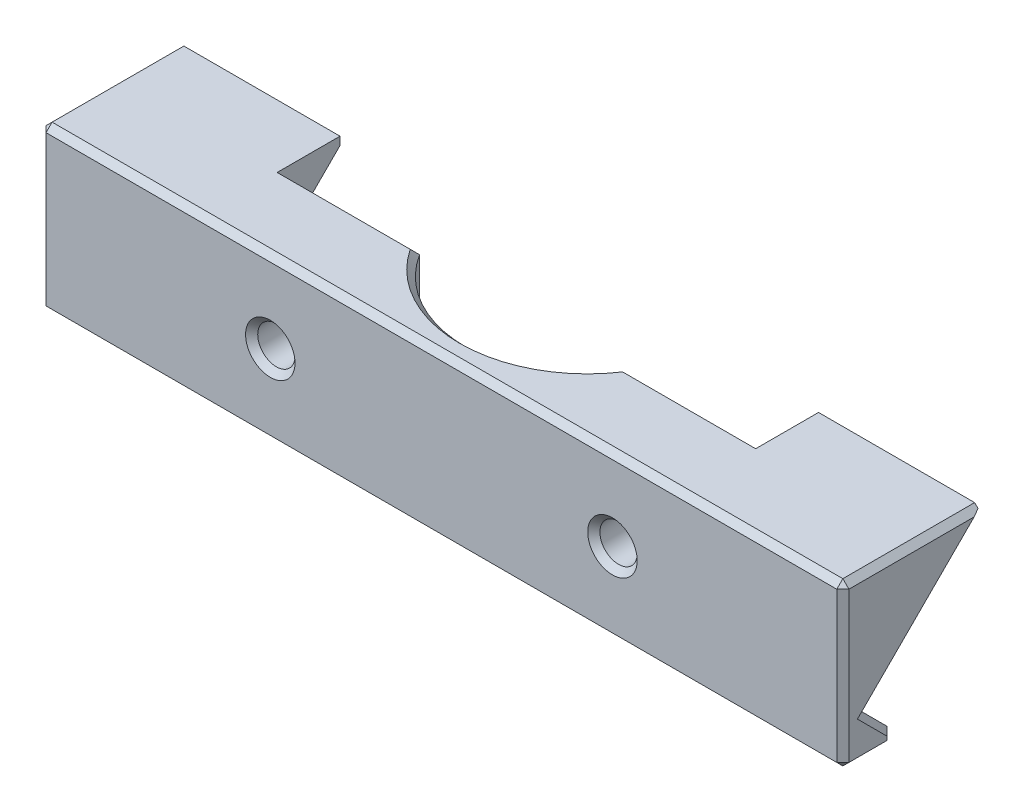
from build123d import *

# Parameters (mm, degrees)
SKIZZE1_W                       = 59
SKIZZE1_H                       = 20
AUFSATZ_LINEAR_AUSTRAGEN1_DEPTH = 10
AUFSATZ_LINEAR_AUSTRAGEN2_DEPTH = 20
SKIZZE3_R                       = 15
SCHNITT_LINEAR_AUSTRAGEN1_DEPTH = 20
SKIZZE4_R                       = 2.3
SCHNITT_LINEAR_AUSTRAGEN2_DEPTH = 10
SKIZZE5_R                       = 3.75
SCHNITT_LINEAR_AUSTRAGEN3_DEPTH = 3
SCHNITT_LINEAR_AUSTRAGEN4_DEPTH = 20
VERRUNDUNG1_R                   = 2


with BuildPart() as part:
    # Skizze1 → Aufsatz-Linear austragen1 (new body)
    with BuildSketch(Plane.XY):
        with Locations((0, 10)):
            Rectangle(SKIZZE1_W, SKIZZE1_H)
    extrude(amount=AUFSATZ_LINEAR_AUSTRAGEN1_DEPTH)

    # Skizze2 → Aufsatz-Linear austragen2 (add)
    with BuildSketch(Plane.ZY.offset(29.5)):
        Polygon((7.142135624, 4.857864376), (-7, 19), (-7, 20), (0, 20), (10, 20), (10, 0), (2.284271247, 0), align=None)
    aufsatz_linear_austragen2 = extrude(amount=AUFSATZ_LINEAR_AUSTRAGEN2_DEPTH)

    # Spiegeln1: Aufsatz-Linear austragen2 across plane
    add(aufsatz_linear_austragen2.mirror(Plane(origin=(0, 0, 0), x_dir=(0, 0, 1), z_dir=(1, 0, 0))))

    # Skizze3 → Schnitt-Linear austragen1 (cut)
    with BuildSketch(Plane.XZ):
        with Locations((0, -8)):
            Circle(SKIZZE3_R)
    extrude(amount=-SCHNITT_LINEAR_AUSTRAGEN1_DEPTH, mode=Mode.SUBTRACT)

    # Skizze4 → Schnitt-Linear austragen2 (cut)
    with BuildSketch(Plane(origin=(0, 0, 0), x_dir=(-1, 0, 0), z_dir=(0, 0, -1))):
        with Locations((-21.09428877, 10)):
            Circle(SKIZZE4_R)
        with Locations(Location((21.09428877, 10, 0), (0, 0, 180))):
            Circle(SKIZZE4_R)
    extrude(amount=-SCHNITT_LINEAR_AUSTRAGEN2_DEPTH, mode=Mode.SUBTRACT)

    # Skizze5 → Schnitt-Linear austragen3 (cut)
    with BuildSketch(Plane(origin=(0, 0, 0), x_dir=(-1, 0, 0), z_dir=(0, 0, -1))):
        with Locations((-21.09428877, 10)):
            Circle(SKIZZE5_R)
        with Locations((21.09428877, 10)):
            Circle(SKIZZE5_R)
    extrude(amount=-SCHNITT_LINEAR_AUSTRAGEN3_DEPTH, mode=Mode.SUBTRACT)

    # Skizze6 → Schnitt-Linear austragen4 (cut)
    with BuildSketch(Plane(origin=(49.5, 0, 0), x_dir=(0, 0, -1), z_dir=(1, 0, 0))):
        Polygon((-3.784271247, 1.5), (-3.784271247, 0), (-1.831080062, -0.949282867), (-1.396270995, 1.527811212), align=None)
    schnitt_linear_austragen4 = extrude(amount=-SCHNITT_LINEAR_AUSTRAGEN4_DEPTH, mode=Mode.SUBTRACT)

    # Spiegeln2: Schnitt-Linear austragen4 across plane
    add(schnitt_linear_austragen4.mirror(Plane(origin=(0, 0, 0), x_dir=(0, 0, 1), z_dir=(1, 0, 0))), mode=Mode.SUBTRACT)

    # Fase1
    # the kernel refuses this chamfer: 0.75 mm, written as the material it takes off along each edge
    with BuildSketch(Plane(origin=(49, 19.5, 9.5), x_dir=(-0.7071067811865492, 0.7071067811865459, 0), z_dir=(0.5773502691896248, 0.5773502691896276, 0.5773502691896248)), Plane(origin=(-49, 19.5, 9.5), x_dir=(-0.7071067811865492, -0.7071067811865459, 0), z_dir=(-0.5773502691896248, 0.5773502691896276, 0.5773502691896248))) as fase1_piece_1:
        Polygon((-0.530330086, -0.306186218), (0.530330086, -0.306186218), (0, 0.612372436), align=None)
    extrude(amount=0.952627944, mode=Mode.SUBTRACT)
    with BuildSketch(Plane(origin=(49, 0.5, 4.284271247), x_dir=(-0.7071067811865476, -1.4654196281048569e-15, -0.7071067811865476), z_dir=(0.5773502691896273, -0.5773502691896242, -0.577350269189626)), Plane(origin=(-49, 0.5, 9.5), x_dir=(-0.7071067811865458, 0.7071067811865491, 0), z_dir=(-0.5773502691896266, -0.577350269189624, 0.5773502691896268)), Plane(origin=(-49, 0.5, 4.284271247), x_dir=(0, 0.7071067811865487, -0.7071067811865464), z_dir=(-0.577350269189627, -0.5773502691896243, -0.5773502691896261)), Plane(origin=(49, 0.5, 9.5), x_dir=(-0.7071067811865457, -0.7071067811865492, 0), z_dir=(0.5773502691896267, -0.5773502691896237, 0.5773502691896267))) as fase1_piece_2:
        Polygon((-0.530330086, 0.306186218), (0.530330086, 0.306186218), (0, -0.612372436), align=None)
    extrude(amount=0.952627944, mode=Mode.SUBTRACT)
    with BuildSketch(Plane(origin=(-21.09428877, 10, 10), x_dir=(1, 0, 0), z_dir=(0, 1, 0))) as fase1_piece_3:
        with BuildLine():
            Line((2.278786797, 0.771213203), (3.071213203, -0.021213203))
            Line((3.071213203, -0.021213203), (3.071213203, -0.036213203))
            ThreePointArc((3.071213203, -0.036213203), (2.685606602, -0.015), (2.3, -0.015))
            Line((2.3, -0.015), (2.285, 0))
            ThreePointArc((2.285, 0), (2.285, 0.385606602), (2.263786797, 0.771213203))
            Line((2.263786797, 0.771213203), (2.278786797, 0.771213203))
        make_face()
    revolve(axis=Axis((-21.09428877, 10, 10), (0, 0, -1)), mode=Mode.SUBTRACT)
    with BuildSketch(Plane(origin=(21.09428877, 10, 10), x_dir=(-1, 0, 0), z_dir=(0, -1, 0))) as fase1_piece_4:
        with BuildLine():
            Line((3.071213203, -0.021213203), (2.278786797, 0.771213203))
            Line((2.278786797, 0.771213203), (2.263786797, 0.771213203))
            ThreePointArc((2.263786797, 0.771213203), (2.285, 0.385606602), (2.285, 0))
            Line((2.285, 0), (2.3, -0.015))
            ThreePointArc((2.3, -0.015), (2.685606602, -0.015), (3.071213203, -0.036213203))
            Line((3.071213203, -0.036213203), (3.071213203, -0.021213203))
        make_face()
    revolve(axis=Axis((21.09428877, 10, 10), (0, 0, -1)), mode=Mode.SUBTRACT)
    with BuildSketch(Plane(origin=(49.5, 20, 0), x_dir=(-0.9996219169112969, 0.027495876610582292, 0), z_dir=(0, 0, 1))) as fase1_piece_5:
        with BuildLine():
            Line((0.771504896, 0), (-0.042410366, 0.770338345))
            Line((-0.042410366, 0.770338345), (-0.057404695, 0.769925907))
            ThreePointArc((-0.057404695, 0.769925907), (-0.02559692, 0.385048372), (-0.014994329, -0.000412438))
            Line((-0.014994329, -0.000412438), (0.000412438, -0.014994329))
            ThreePointArc((0.000412438, -0.014994329), (0.385873249, -0.004391737), (0.771917335, -0.014994329))
            Line((0.771917335, -0.014994329), (0.771504896, 0))
        make_face()
    extrude(amount=11.928762241, mode=Mode.SUBTRACT)
    with BuildSketch(Plane(origin=(49.5, 4.857864376, 7.142135624), x_dir=(-0.9996219169112968, -0.01944252080601377, -0.01944252080601398), z_dir=(0, 0.7071067811865513, -0.7071067811865438)), Plane(origin=(51.428762241, 0, 3.784271247), x_dir=(0, -0.027495876610586376, 0.9996219169112968), z_dir=(-1, 0, 0))) as fase1_piece_6:
        with BuildLine():
            Line((0.771504896, 0), (-0.042410366, 0.770338345))
            Line((-0.042410366, 0.770338345), (-0.057404695, 0.769925907))
            ThreePointArc((-0.057404695, 0.769925907), (-0.02559692, 0.385048372), (-0.014994329, -0.000412438))
            Line((-0.014994329, -0.000412438), (0.000412438, -0.014994329))
            ThreePointArc((0.000412438, -0.014994329), (0.385873249, -0.004391737), (0.771917335, -0.014994329))
            Line((0.771917335, -0.014994329), (0.771504896, 0))
        make_face()
    extrude(amount=21.928762241, mode=Mode.SUBTRACT)
    with BuildSketch(Plane(origin=(49.5, 0.13615914, 2.420430388), x_dir=(-0.9996219169112968, 0.01944252080601445, -0.019442520806014447), z_dir=(0, 0.7071067811865475, 0.7071067811865476))) as fase1_piece_7:
        with BuildLine():
            Line((0.771504896, 0), (-0.042410366, 0.770338345))
            Line((-0.042410366, 0.770338345), (-0.057404695, 0.769925907))
            ThreePointArc((-0.057404695, 0.769925907), (-0.02559692, 0.385048372), (-0.014994329, -0.000412438))
            Line((-0.014994329, -0.000412438), (0.000412438, -0.014994329))
            ThreePointArc((0.000412438, -0.014994329), (0.385873249, -0.004391737), (0.771917335, -0.014994329))
            Line((0.771917335, -0.014994329), (0.771504896, 0))
        make_face()
    extrude(amount=6.677499583, mode=Mode.SUBTRACT)
    with BuildSketch(Plane(origin=(49.5, 3.428762241, 3.784271247), x_dir=(0.027495876610582164, 0, 0.9996219169112969), z_dir=(0, -1, 0)), Plane(origin=(-49.5, 3.428762241, 3.784271247), x_dir=(0.9996219169112968, 0, -0.027495876610586317), z_dir=(0, -1, 0))) as fase1_piece_8:
        with BuildLine():
            Line((0.771504896, 0), (-0.042410366, 0.770338345))
            Line((-0.042410366, 0.770338345), (-0.057404695, 0.769925907))
            ThreePointArc((-0.057404695, 0.769925907), (-0.02559692, 0.385048372), (-0.014994329, -0.000412438))
            Line((-0.014994329, -0.000412438), (0.000412438, -0.014994329))
            ThreePointArc((0.000412438, -0.014994329), (0.385873249, -0.004391737), (0.771917335, -0.014994329))
            Line((0.771917335, -0.014994329), (0.771504896, 0))
        make_face()
    extrude(amount=5.357524482, mode=Mode.SUBTRACT)
    with BuildSketch(Plane(origin=(-49.5, 0, 11.928762241), x_dir=(0.9996219169112968, -0.027495876610586487, 0), z_dir=(0, 0, -1))) as fase1_piece_9:
        with BuildLine():
            Line((0.771504896, 0), (-0.042410366, -0.770338345))
            Line((-0.042410366, -0.770338345), (-0.057404695, -0.769925907))
            ThreePointArc((-0.057404695, -0.769925907), (-0.02559692, -0.385048372), (-0.014994329, 0.000412438))
            Line((-0.014994329, 0.000412438), (0.000412438, 0.014994329))
            ThreePointArc((0.000412438, 0.014994329), (0.385873249, 0.004391737), (0.771917335, 0.014994329))
            Line((0.771917335, 0.014994329), (0.771504896, 0))
        make_face()
    extrude(amount=10.073253234, mode=Mode.SUBTRACT)
    with BuildSketch(Plane(origin=(49.5, 21.928762241, 10), x_dir=(-0.9996219169112968, 0, 0.027495876610586893), z_dir=(0, -1, 0)), Plane(origin=(-49.5, 21.928762241, 10), x_dir=(-0.027495876610582164, 0, -0.9996219169112969), z_dir=(0, -1, 0))) as fase1_piece_10:
        with BuildLine():
            Line((0.771504896, 0), (-0.042410366, 0.770338345))
            Line((-0.042410366, 0.770338345), (-0.057404695, 0.769925907))
            ThreePointArc((-0.057404695, 0.769925907), (-0.02559692, 0.385048372), (-0.014994329, -0.000412438))
            Line((-0.014994329, -0.000412438), (0.000412438, -0.014994329))
            ThreePointArc((0.000412438, -0.014994329), (0.385873249, -0.004391737), (0.771917335, -0.014994329))
            Line((0.771917335, -0.014994329), (0.771504896, 0))
        make_face()
    extrude(amount=23.857524482, mode=Mode.SUBTRACT)
    with BuildSketch(Plane(origin=(51.428762241, 20, 10), x_dir=(0, 0.027495876610586768, -0.9996219169112968), z_dir=(-1, 0, 0))) as fase1_piece_11:
        with BuildLine():
            Line((0.771504896, 0), (-0.042410366, 0.770338345))
            Line((-0.042410366, 0.770338345), (-0.057404695, 0.769925907))
            ThreePointArc((-0.057404695, 0.769925907), (-0.02559692, 0.385048372), (-0.014994329, -0.000412438))
            Line((-0.014994329, -0.000412438), (0.000412438, -0.014994329))
            ThreePointArc((0.000412438, -0.014994329), (0.385873249, -0.004391737), (0.771917335, -0.014994329))
            Line((0.771917335, -0.014994329), (0.771504896, 0))
        make_face()
    extrude(amount=102.857524482, mode=Mode.SUBTRACT)
    with BuildSketch(Plane(origin=(51.428762241, 0, 10), x_dir=(0, -0.02749587661058636, -0.9996219169112968), z_dir=(-1, 0, 0))) as fase1_piece_12:
        with BuildLine():
            Line((0.771504896, 0), (-0.042410366, -0.770338345))
            Line((-0.042410366, -0.770338345), (-0.057404695, -0.769925907))
            ThreePointArc((-0.057404695, -0.769925907), (-0.02559692, -0.385048372), (-0.014994329, 0.000412438))
            Line((-0.014994329, 0.000412438), (0.000412438, 0.014994329))
            ThreePointArc((0.000412438, 0.014994329), (0.385873249, 0.004391737), (0.771917335, 0.014994329))
            Line((0.771917335, 0.014994329), (0.771504896, 0))
        make_face()
    extrude(amount=102.857524482, mode=Mode.SUBTRACT)
    with BuildSketch(Plane(origin=(49.5, 0, 11.928762241), x_dir=(-0.9996219169112968, -0.027495876610586487, 0), z_dir=(0, 0, -1))) as fase1_piece_13:
        with BuildLine():
            Line((0.771504896, 0), (-0.042410366, 0.770338345))
            Line((-0.042410366, 0.770338345), (-0.057404695, 0.769925907))
            ThreePointArc((-0.057404695, 0.769925907), (-0.02559692, 0.385048372), (-0.014994329, -0.000412438))
            Line((-0.014994329, -0.000412438), (0.000412438, -0.014994329))
            ThreePointArc((0.000412438, -0.014994329), (0.385873249, -0.004391737), (0.771917335, -0.014994329))
            Line((0.771917335, -0.014994329), (0.771504896, 0))
        make_face()
    extrude(amount=10.073253234, mode=Mode.SUBTRACT)
    with BuildSketch(Plane(origin=(29.5, 0, -1.928762241), x_dir=(-0.9996219169112968, -0.02749587661058636, 0), z_dir=(0, 0, 1)), Plane(origin=(-29.5, 0, 3.784271247), x_dir=(0.9996219169112965, -0.027495876610589942, 0), z_dir=(0, 0, -1))) as fase1_piece_14:
        with BuildLine():
            Line((0.771504896, 0), (-0.042410366, -0.770338345))
            Line((-0.042410366, -0.770338345), (-0.057404695, -0.769925907))
            ThreePointArc((-0.057404695, -0.769925907), (-0.02559692, -0.385048372), (-0.014994329, 0.000412438))
            Line((-0.014994329, 0.000412438), (0.000412438, 0.014994329))
            ThreePointArc((0.000412438, 0.014994329), (0.385873249, 0.004391737), (0.771917335, 0.014994329))
            Line((0.771917335, 0.014994329), (0.771504896, 0))
        make_face()
    extrude(amount=5.713033488, mode=Mode.SUBTRACT)
    with BuildSketch(Plane(origin=(31.428762241, 0, 0), x_dir=(0, -0.027495876610586372, 0.9996219169112968), z_dir=(-1, 0, 0)), Plane(origin=(-10.759815299, 0, 0), x_dir=(0, -0.027495876610586372, 0.9996219169112968), z_dir=(-1, 0, 0))) as fase1_piece_15:
        with BuildLine():
            Line((0.771504896, 0), (-0.042410366, 0.770338345))
            Line((-0.042410366, 0.770338345), (-0.057404695, 0.769925907))
            ThreePointArc((-0.057404695, 0.769925907), (-0.02559692, 0.385048372), (-0.014994329, -0.000412438))
            Line((-0.014994329, -0.000412438), (0.000412438, -0.014994329))
            ThreePointArc((0.000412438, -0.014994329), (0.385873249, -0.004391737), (0.771917335, -0.014994329))
            Line((0.771917335, -0.014994329), (0.771504896, 0))
        make_face()
    extrude(amount=20.668946941, mode=Mode.SUBTRACT)
    with BuildSketch(Plane(origin=(0, 0, -8), x_dir=(0.9073469377071578, 0, 0.42038260505573166), z_dir=(0.42038260505573166, 0, -0.9073469377071578))) as fase1_piece_16:
        with BuildLine():
            Line((15.771213203, 0.021213203), (14.978786797, -0.771213203))
            Line((14.978786797, -0.771213203), (14.963786797, -0.771213203))
            ThreePointArc((14.963786797, -0.771213203), (14.985, -0.385606602), (14.985, 0))
            Line((14.985, 0), (15, 0.015))
            ThreePointArc((15, 0.015), (15.385606602, 0.015), (15.771213203, 0.036213203))
            Line((15.771213203, 0.036213203), (15.771213203, 0.021213203))
        make_face()
    revolve(axis=Axis((0, 0, -8), (0, -1, 0)), revolution_arc=130.282509401, mode=Mode.SUBTRACT)
    with BuildSketch(Plane(origin=(-51.428762241, 0, 3.784271247), x_dir=(0, -0.027495876610586376, 0.9996219169112968), z_dir=(1, 0, 0)), Plane(origin=(-49.5, 4.857864376, 7.142135624), x_dir=(0.9996219169112968, -0.01944252080601377, -0.01944252080601398), z_dir=(0, 0.7071067811865513, -0.7071067811865438))) as fase1_piece_17:
        with BuildLine():
            Line((0.771504896, 0), (-0.042410366, -0.770338345))
            Line((-0.042410366, -0.770338345), (-0.057404695, -0.769925907))
            ThreePointArc((-0.057404695, -0.769925907), (-0.02559692, -0.385048372), (-0.014994329, 0.000412438))
            Line((-0.014994329, 0.000412438), (0.000412438, 0.014994329))
            ThreePointArc((0.000412438, 0.014994329), (0.385873249, 0.004391737), (0.771917335, 0.014994329))
            Line((0.771917335, 0.014994329), (0.771504896, 0))
        make_face()
    extrude(amount=21.928762241, mode=Mode.SUBTRACT)
    with BuildSketch(Plane(origin=(-49.5, 0.13615914, 2.420430388), x_dir=(0.9996219169112968, 0.01944252080601436, -0.019442520806014357), z_dir=(0, 0.7071067811865475, 0.7071067811865476))) as fase1_piece_18:
        with BuildLine():
            Line((0.771504896, 0), (-0.042410366, -0.770338345))
            Line((-0.042410366, -0.770338345), (-0.057404695, -0.769925907))
            ThreePointArc((-0.057404695, -0.769925907), (-0.02559692, -0.385048372), (-0.014994329, 0.000412438))
            Line((-0.014994329, 0.000412438), (0.000412438, 0.014994329))
            ThreePointArc((0.000412438, 0.014994329), (0.385873249, 0.004391737), (0.771917335, 0.014994329))
            Line((0.771917335, 0.014994329), (0.771504896, 0))
        make_face()
    extrude(amount=6.677499583, mode=Mode.SUBTRACT)
    with BuildSketch(Plane(origin=(-29.5, 20, 0), x_dir=(0, 0.027495876610586778, 0.9996219169112968), z_dir=(1, 0, 0)), Plane(origin=(10.759815299, 20, 0), x_dir=(0, 0.027495876610586778, 0.9996219169112968), z_dir=(1, 0, 0))) as fase1_piece_19:
        with BuildLine():
            Line((0.771504896, 0), (-0.042410366, 0.770338345))
            Line((-0.042410366, 0.770338345), (-0.057404695, 0.769925907))
            ThreePointArc((-0.057404695, 0.769925907), (-0.02559692, 0.385048372), (-0.014994329, -0.000412438))
            Line((-0.014994329, -0.000412438), (0.000412438, -0.014994329))
            ThreePointArc((0.000412438, -0.014994329), (0.385873249, -0.004391737), (0.771917335, -0.014994329))
            Line((0.771917335, -0.014994329), (0.771504896, 0))
        make_face()
    extrude(amount=18.740184701, mode=Mode.SUBTRACT)
    with BuildSketch(Plane(origin=(0, 20, -8), x_dir=(0.9073469377071578, 0, 0.42038260505573166), z_dir=(0.42038260505573166, 0, -0.9073469377071578))) as fase1_piece_20:
        with BuildLine():
            Line((14.978786797, 0.771213203), (15.771213203, -0.021213203))
            Line((15.771213203, -0.021213203), (15.771213203, -0.036213203))
            ThreePointArc((15.771213203, -0.036213203), (15.385606602, -0.015), (15, -0.015))
            Line((15, -0.015), (14.985, 0))
            ThreePointArc((14.985, 0), (14.985, 0.385606602), (14.963786797, 0.771213203))
            Line((14.963786797, 0.771213203), (14.978786797, 0.771213203))
        make_face()
    revolve(axis=Axis((0, 20, -8), (0, -1, 0)), revolution_arc=130.282509401, mode=Mode.SUBTRACT)
    with BuildSketch(Plane(origin=(-49.5, 20, 0), x_dir=(0.9996219169112969, 0.027495876610582292, 0), z_dir=(0, 0, 1))) as fase1_piece_21:
        with BuildLine():
            Line((0.771504896, 0), (-0.042410366, -0.770338345))
            Line((-0.042410366, -0.770338345), (-0.057404695, -0.769925907))
            ThreePointArc((-0.057404695, -0.769925907), (-0.02559692, -0.385048372), (-0.014994329, 0.000412438))
            Line((-0.014994329, 0.000412438), (0.000412438, 0.014994329))
            ThreePointArc((0.000412438, 0.014994329), (0.385873249, 0.004391737), (0.771917335, 0.014994329))
            Line((0.771917335, 0.014994329), (0.771504896, 0))
        make_face()
    extrude(amount=11.928762241, mode=Mode.SUBTRACT)
    with BuildSketch(Plane(origin=(-49.5, 20, -8.928762241), x_dir=(0.9996219169112968, 0.027495876610586893, -2.912407812628222e-14), z_dir=(0, 1.059216206806384e-12, 1.0))) as fase1_piece_22:
        with BuildLine():
            Line((0.771504896, 0), (-0.042410366, -0.770338345))
            Line((-0.042410366, -0.770338345), (-0.057404695, -0.769925907))
            ThreePointArc((-0.057404695, -0.769925907), (-0.02559692, -0.385048372), (-0.014994329, 0.000412438))
            Line((-0.014994329, 0.000412438), (0.000412438, 0.014994329))
            ThreePointArc((0.000412438, 0.014994329), (0.385873249, 0.004391737), (0.771917335, 0.014994329))
            Line((0.771917335, 0.014994329), (0.771504896, 0))
        make_face()
    extrude(amount=8.928762241, mode=Mode.SUBTRACT)
    with BuildSketch(Plane(origin=(49.5, 20, -8.928762241), x_dir=(-0.9996219169112968, 0.027495876610586893, -2.912407812628222e-14), z_dir=(0, 1.059216206806384e-12, 1.0))) as fase1_piece_23:
        with BuildLine():
            Line((0.771504896, 0), (-0.042410366, 0.770338345))
            Line((-0.042410366, 0.770338345), (-0.057404695, 0.769925907))
            ThreePointArc((-0.057404695, 0.769925907), (-0.02559692, 0.385048372), (-0.014994329, -0.000412438))
            Line((-0.014994329, -0.000412438), (0.000412438, -0.014994329))
            ThreePointArc((0.000412438, -0.014994329), (0.385873249, -0.004391737), (0.771917335, -0.014994329))
            Line((0.771917335, -0.014994329), (0.771504896, 0))
        make_face()
    extrude(amount=8.928762241, mode=Mode.SUBTRACT)
    with BuildSketch(Plane(origin=(49.5, 3.494023516, 8.505976484), x_dir=(-0.9996219169112968, -0.01944252080601521, -0.019442520806015415), z_dir=(0, 0.7071067811865513, -0.7071067811865438))) as fase1_piece_24a_section:
        with BuildLine():
            Line((0.771504896, 0), (-0.042410366, 0.770338345))
            Line((-0.042410366, 0.770338345), (-0.057404695, 0.769925907))
            ThreePointArc((-0.057404695, 0.769925907), (-0.02559692, 0.385048372), (-0.014994329, -0.000412438))
            Line((-0.014994329, -0.000412438), (0.000412438, -0.014994329))
            ThreePointArc((0.000412438, -0.014994329), (0.385873249, -0.004391737), (0.771917335, -0.014994329))
            Line((0.771917335, -0.014994329), (0.771504896, 0))
        make_face()
    fase1_piece_24a = extrude(amount=23.857524482, mode=Mode.PRIVATE)
    fase1_piece_24a = split(fase1_piece_24a, bisect_by=Plane(origin=(49.25265478, 5.032763859, 7.317035106), z_dir=(0, -0.7071067811865476, 0.7071067811865475)), keep=Keep.TOP, mode=Mode.PRIVATE)
    with BuildSketch(Plane(origin=(49.5, 0.13615914, 2.420430388), x_dir=(-0.9996219169112968, 0.01944252080601445, -0.019442520806014447), z_dir=(0, 0.7071067811865475, 0.7071067811865476))) as fase1_piece_24b_section:
        with BuildLine():
            Line((0.771504896, 0), (-0.042410366, 0.770338345))
            Line((-0.042410366, 0.770338345), (-0.057404695, 0.769925907))
            ThreePointArc((-0.057404695, 0.769925907), (-0.02559692, 0.385048372), (-0.014994329, -0.000412438))
            Line((-0.014994329, -0.000412438), (0.000412438, -0.014994329))
            ThreePointArc((0.000412438, -0.014994329), (0.385873249, -0.004391737), (0.771917335, -0.014994329))
            Line((0.771917335, -0.014994329), (0.771504896, 0))
        make_face()
    fase1_piece_24b = extrude(amount=8.606261823, mode=Mode.PRIVATE)
    fase1_piece_24b = split(fase1_piece_24b, bisect_by=Plane(origin=(49.25265478, 4.682964894, 7.317035106), z_dir=(0, 0.7071067811865438, 0.7071067811865513)), keep=Keep.TOP, mode=Mode.PRIVATE)
    fase1_piece_24 = fase1_piece_24a & fase1_piece_24b
    add(fase1_piece_24, mode=Mode.SUBTRACT)
    with BuildSketch(Plane(origin=(29.5, 0, -1.928762241), x_dir=(-0.9996219169112968, -0.02749587661058636, 0), z_dir=(0, 0, 1))) as fase1_piece_25a_section:
        with BuildLine():
            Line((0.771504896, 0), (-0.042410366, -0.770338345))
            Line((-0.042410366, -0.770338345), (-0.057404695, -0.769925907))
            ThreePointArc((-0.057404695, -0.769925907), (-0.02559692, -0.385048372), (-0.014994329, 0.000412438))
            Line((-0.014994329, 0.000412438), (0.000412438, 0.014994329))
            ThreePointArc((0.000412438, 0.014994329), (0.385873249, 0.004391737), (0.771917335, 0.014994329))
            Line((0.771917335, 0.014994329), (0.771504896, 0))
        make_face()
    fase1_piece_25a = extrude(amount=7.641795729, mode=Mode.PRIVATE)
    fase1_piece_25a = split(fase1_piece_25a, bisect_by=Plane(origin=(29.25265478, 0.24734522, 3.784271247), z_dir=(0, 0, 1)), keep=Keep.TOP, mode=Mode.PRIVATE)
    with BuildSketch(Plane(origin=(51.428762241, 0, 3.784271247), x_dir=(0, -0.027495876610586376, 0.9996219169112968), z_dir=(-1, 0, 0))) as fase1_piece_25b_section:
        with BuildLine():
            Line((0.771504896, 0), (-0.042410366, 0.770338345))
            Line((-0.042410366, 0.770338345), (-0.057404695, 0.769925907))
            ThreePointArc((-0.057404695, 0.769925907), (-0.02559692, 0.385048372), (-0.014994329, -0.000412438))
            Line((-0.014994329, -0.000412438), (0.000412438, -0.014994329))
            ThreePointArc((0.000412438, -0.014994329), (0.385873249, -0.004391737), (0.771917335, -0.014994329))
            Line((0.771917335, -0.014994329), (0.771504896, 0))
        make_face()
    fase1_piece_25b = extrude(amount=23.857524482, mode=Mode.PRIVATE)
    fase1_piece_25b = split(fase1_piece_25b, bisect_by=Plane(origin=(29.5, 0.24734522, 4.031616468), z_dir=(-1, 0, 0)), keep=Keep.TOP, mode=Mode.PRIVATE)
    fase1_piece_25 = fase1_piece_25a & fase1_piece_25b
    add(fase1_piece_25, mode=Mode.SUBTRACT)
    with BuildSketch(Plane(origin=(-51.428762241, 0, 3.784271247), x_dir=(0, -0.027495876610586376, 0.9996219169112968), z_dir=(1, 0, 0))) as fase1_piece_26a_section:
        with BuildLine():
            Line((0.771504896, 0), (-0.042410366, -0.770338345))
            Line((-0.042410366, -0.770338345), (-0.057404695, -0.769925907))
            ThreePointArc((-0.057404695, -0.769925907), (-0.02559692, -0.385048372), (-0.014994329, 0.000412438))
            Line((-0.014994329, 0.000412438), (0.000412438, 0.014994329))
            ThreePointArc((0.000412438, 0.014994329), (0.385873249, 0.004391737), (0.771917335, 0.014994329))
            Line((0.771917335, 0.014994329), (0.771504896, 0))
        make_face()
    fase1_piece_26a = extrude(amount=23.857524482, mode=Mode.PRIVATE)
    fase1_piece_26a = split(fase1_piece_26a, bisect_by=Plane(origin=(-29.5, 0.24734522, 4.031616468), z_dir=(1, 0, 0)), keep=Keep.TOP, mode=Mode.PRIVATE)
    with BuildSketch(Plane(origin=(-29.5, 0, 5.713033488), x_dir=(0.9996219169112968, -0.02749587661058636, 0), z_dir=(0, 0, -1))) as fase1_piece_26b_section:
        with BuildLine():
            Line((0.771504896, 0), (-0.042410366, -0.770338345))
            Line((-0.042410366, -0.770338345), (-0.057404695, -0.769925907))
            ThreePointArc((-0.057404695, -0.769925907), (-0.02559692, -0.385048372), (-0.014994329, 0.000412438))
            Line((-0.014994329, 0.000412438), (0.000412438, 0.014994329))
            ThreePointArc((0.000412438, 0.014994329), (0.385873249, 0.004391737), (0.771917335, 0.014994329))
            Line((0.771917335, 0.014994329), (0.771504896, 0))
        make_face()
    fase1_piece_26b = extrude(amount=7.641795729, mode=Mode.PRIVATE)
    fase1_piece_26b = split(fase1_piece_26b, bisect_by=Plane(origin=(-29.25265478, 0.24734522, 3.784271247), z_dir=(0, 0, 1)), keep=Keep.TOP, mode=Mode.PRIVATE)
    fase1_piece_26 = fase1_piece_26a & fase1_piece_26b
    add(fase1_piece_26, mode=Mode.SUBTRACT)
    with BuildSketch(Plane(origin=(-49.5, 3.494023516, 8.505976484), x_dir=(0.9996219169112968, -0.019442520806014923, -0.019442520806015127), z_dir=(0, 0.7071067811865513, -0.7071067811865438))) as fase1_piece_27a_section:
        with BuildLine():
            Line((0.771504896, 0), (-0.042410366, -0.770338345))
            Line((-0.042410366, -0.770338345), (-0.057404695, -0.769925907))
            ThreePointArc((-0.057404695, -0.769925907), (-0.02559692, -0.385048372), (-0.014994329, 0.000412438))
            Line((-0.014994329, 0.000412438), (0.000412438, 0.014994329))
            ThreePointArc((0.000412438, 0.014994329), (0.385873249, 0.004391737), (0.771917335, 0.014994329))
            Line((0.771917335, 0.014994329), (0.771504896, 0))
        make_face()
    fase1_piece_27a = extrude(amount=23.857524482, mode=Mode.PRIVATE)
    fase1_piece_27a = split(fase1_piece_27a, bisect_by=Plane(origin=(-49.25265478, 5.032763859, 7.317035106), z_dir=(0, -0.7071067811865476, 0.7071067811865475)), keep=Keep.TOP, mode=Mode.PRIVATE)
    with BuildSketch(Plane(origin=(-49.5, 0.13615914, 2.420430388), x_dir=(0.9996219169112968, 0.01944252080601436, -0.019442520806014357), z_dir=(0, 0.7071067811865475, 0.7071067811865476))) as fase1_piece_27b_section:
        with BuildLine():
            Line((0.771504896, 0), (-0.042410366, -0.770338345))
            Line((-0.042410366, -0.770338345), (-0.057404695, -0.769925907))
            ThreePointArc((-0.057404695, -0.769925907), (-0.02559692, -0.385048372), (-0.014994329, 0.000412438))
            Line((-0.014994329, 0.000412438), (0.000412438, 0.014994329))
            ThreePointArc((0.000412438, 0.014994329), (0.385873249, 0.004391737), (0.771917335, 0.014994329))
            Line((0.771917335, 0.014994329), (0.771504896, 0))
        make_face()
    fase1_piece_27b = extrude(amount=8.606261823, mode=Mode.PRIVATE)
    fase1_piece_27b = split(fase1_piece_27b, bisect_by=Plane(origin=(-49.25265478, 4.682964894, 7.317035106), z_dir=(0, 0.7071067811865438, 0.7071067811865513)), keep=Keep.TOP, mode=Mode.PRIVATE)
    fase1_piece_27 = fase1_piece_27a & fase1_piece_27b
    add(fase1_piece_27, mode=Mode.SUBTRACT)

    # Verrundung1
    verrundung1_edges = [part.edges().sort_by_distance(p)[0] for p in [
        (-29.5, 15.625, 0),
        (29.5, 15.625, 0),
    ]]
    fillet(verrundung1_edges, radius=VERRUNDUNG1_R)


solid = part.part
